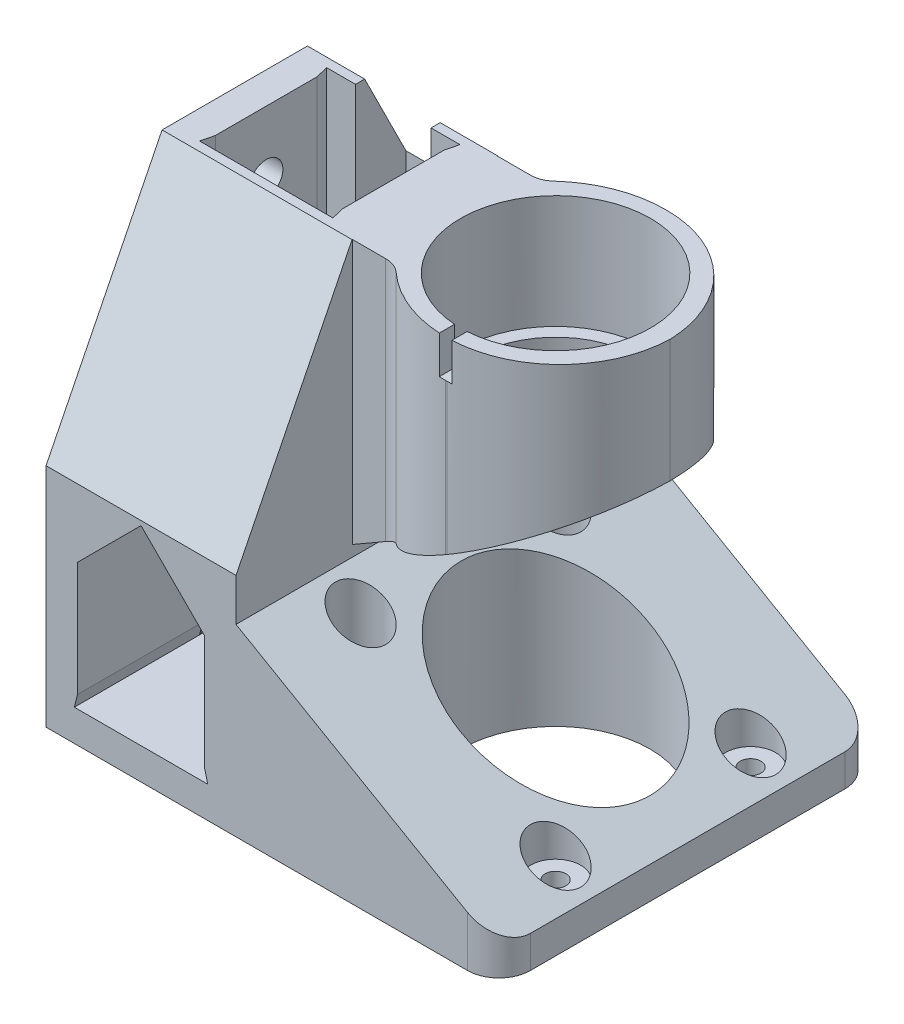
from build123d import *

# Parameters (mm, degrees)
SKETCH1_W               = 72
SKETCH1_H               = 60
BOSS_EXTRUDE1_DEPTH     = 5
SKETCH2_W               = 5
SKETCH2_H               = 60
BOSS_EXTRUDE2_DEPTH     = 68
SKETCH3_W               = 5
SKETCH3_H               = 60
BOSS_EXTRUDE3_DEPTH     = 68
BOSS_EXTRUDE4_DEPTH     = 60
CHAMFER1_SIZE           = 42
CHAMFER1_SIZE_2         = 24.248711306
CUT_EXTRUDE8_REACH      = 120.798
SKETCH12_W              = 20.2
SKETCH12_H              = 20.2
CUT_EXTRUDE1_DEPTH      = 116.792918609
CUT_EXTRUDE1_DEPTH_BACK = 116.792918609
SKETCH5_R               = 15
SKETCH8_R               = 2.65
CUT_EXTRUDE5_DEPTH      = 10
CUT_EXTRUDE6_DEPTH      = 119.798148134
CUT_EXTRUDE6_DEPTH_BACK = 119.798148134
SKETCH9_R               = 2.65
FILLET1_R               = 5
SKETCH10_R              = 2.65
CUT_EXTRUDE7_DEPTH      = 10
CUT_EXTRUDE9_DEPTH      = 119.798148134
CUT_EXTRUDE9_DEPTH_BACK = 119.798148134
CUT_EXTRUDE10_REACH     = 120.798
SKETCH14_W              = 12
SKETCH14_H              = 8
SKETCH15_W              = 35
SKETCH15_H              = 19.5
BOSS_EXTRUDE5_DEPTH     = 39
SKETCH16_R              = 15.1
CUT_EXTRUDE11_DEPTH     = 109.669222874
SKETCH17_R              = 13
CUT_EXTRUDE12_DEPTH     = 108.917792787
FILLET2_R               = 18
CHAMFER2_START          = 51.76396
CHAMFER2_OUTLINE_R      = 13
CHAMFER2_DEPTH          = 1.73604
CHAMFER2_START_2        = 31
CHAMFER2_2_OUTLINE_R    = 13
CHAMFER2_2_DEPTH        = 20.76396
CHAMFER2_START_3        = -47.5
CHAMFER2_3_DEPTH        = 35
SKETCH6_R               = 1.65
CUT_EXTRUDE2_DEPTH      = 119.798148134
SKETCH7_R               = 4
CUT_EXTRUDE4_DEPTH      = 116.792918609
SKETCH18_W              = 2
SKETCH18_H              = 15
CUT_EXTRUDE13_DEPTH     = 6
CHAMFER3_DEPTH          = 34.854175091
CUT_EXTRUDE14_REACH     = 120.798
SKETCH19_W              = 5.3
SKETCH19_H              = 10
FILLET3_R               = 19


with BuildPart() as part:
    # Sketch1 → Boss-Extrude1 (new body)
    with BuildSketch(Plane(origin=(0, 0, 0), x_dir=(1, 0, 0), z_dir=(0, 1, 0))):
        with Locations((36, 30)):
            Rectangle(SKETCH1_W, SKETCH1_H)
    extrude(amount=BOSS_EXTRUDE1_DEPTH)

    # Sketch2 → Boss-Extrude2 (add)
    with BuildSketch(Plane(origin=(0, 5, 0), x_dir=(1, 0, 0), z_dir=(0, 1, 0))):
        with Locations((2.5, 30)):
            Rectangle(SKETCH2_W, SKETCH2_H)
    extrude(amount=BOSS_EXTRUDE2_DEPTH)

    # Sketch3 → Boss-Extrude3 (add)
    with BuildSketch(Plane(origin=(0, 5, 0), x_dir=(1, 0, 0), z_dir=(0, 1, 0))):
        with Locations((27.7, 30)):
            Rectangle(SKETCH3_W, SKETCH3_H)
    extrude(amount=BOSS_EXTRUDE3_DEPTH)

    # Sketch11 → Boss-Extrude4 (add)
    with BuildSketch(Plane(origin=(0, 0, -60), x_dir=(-1, 0, 0), z_dir=(0, 0, -1))):
        Polygon((-25.2, 25.2), (-15.1, 35.3), (-5, 25.2), (-5, 73), (-25.2, 73), align=None)
    extrude(amount=-BOSS_EXTRUDE4_DEPTH)

    # Chamfer1
    # the kernel refuses this chamfer: 42, 24.248711306 mm, written as the material it adds along each edge
    with BuildSketch(Plane(origin=(30.2, 5, -60), x_dir=(1, 0, 0), z_dir=(0, 0, 1))) as chamfer1_piece_1_section:
        Polygon((CHAMFER1_SIZE, 0), (0, CHAMFER1_SIZE_2), (0, 0), align=None)
    chamfer1_piece_1 = extrude(amount=60, mode=Mode.PRIVATE)
    chamfer1_piece_1 = split(chamfer1_piece_1, bisect_by=Plane(origin=(72, 5, -60), z_dir=(-1, 0, 0)), keep=Keep.TOP, mode=Mode.PRIVATE)
    add(chamfer1_piece_1)

    # Cut-Extrude8: up to this face of the body (flat: up to its plane)
    cut_extrude8_end = Plane(part.part.faces().sort_by_distance((15.1, 5, -30))[0])
    # Sketch12 → Cut-Extrude8 (cut, up to the picked face)
    with BuildSketch(Plane(origin=(0, 73, 0), x_dir=(1, 0, 0), z_dir=(0, 1, 0)), mode=Mode.PRIVATE) as cut_extrude8_sk1:
        with Locations((15.1, 30)):
            Rectangle(SKETCH12_W, SKETCH12_H)
    cut_extrude8_tool1 = split(extrude(cut_extrude8_sk1.sketch, amount=-CUT_EXTRUDE8_REACH, mode=Mode.PRIVATE), bisect_by=cut_extrude8_end, keep=Keep.BOTH, mode=Mode.PRIVATE)
    add(cut_extrude8_tool1.solids().sort_by(Axis((15.1, 73, -30), (0, -1, 0)))[0], mode=Mode.SUBTRACT)

    # Sketch5 → Cut-Extrude1 (cut, two sides: drawn at the far end of the back side and taken through both)
    with BuildSketch(Plane(origin=(0, 5, 0), x_dir=(1, 0, 0), z_dir=(0, 1, 0)).offset(-CUT_EXTRUDE1_DEPTH_BACK)):
        with Locations(Location((51, 30, 0), (0, 0, 270))):
            Circle(SKETCH5_R)
    extrude(amount=CUT_EXTRUDE1_DEPTH + CUT_EXTRUDE1_DEPTH_BACK, mode=Mode.SUBTRACT)

    # Sketch8 → Cut-Extrude5 (cut)
    with BuildSketch(Plane(origin=(5, 0, 0), x_dir=(0, 0, -1), z_dir=(1, 0, 0))):
        with Locations((30, 63)):
            Circle(SKETCH8_R)
    extrude(amount=-CUT_EXTRUDE5_DEPTH, mode=Mode.SUBTRACT)

    # Sketch9 → Cut-Extrude6 (cut, two sides: drawn at the far end of the back side and taken through both)
    with BuildSketch(Plane.XZ.offset(-CUT_EXTRUDE6_DEPTH_BACK)):
        with Locations(Location((15, -30, 0), (0, 0, 270))):
            Circle(SKETCH9_R)
    extrude(amount=CUT_EXTRUDE6_DEPTH + CUT_EXTRUDE6_DEPTH_BACK, mode=Mode.SUBTRACT)

    # Fillet1
    fillet1_edges = [part.edges().sort_by_distance(p)[0] for p in [
        (72, 2.557735027, -60),
        (72, 2.557735027, 0),
    ]]
    fillet(fillet1_edges, radius=FILLET1_R)

    # Sketch10 → Cut-Extrude7 (cut)
    with BuildSketch(Plane.ZY):
        with Locations((-30, 15)):
            Circle(SKETCH10_R)
    extrude(amount=-CUT_EXTRUDE7_DEPTH, mode=Mode.SUBTRACT)

    # Sketch13 → Cut-Extrude9 (cut, two sides: drawn at the far end of the back side and taken through both)
    with BuildSketch(Plane.XY.offset(-CUT_EXTRUDE9_DEPTH_BACK)):
        Polygon((5, 5), (4.5, 5), (5, 7), align=None)
        Polygon((25.2, 5), (25.7, 5), (25.2, 7), align=None)
    extrude(amount=CUT_EXTRUDE9_DEPTH + CUT_EXTRUDE9_DEPTH_BACK, mode=Mode.SUBTRACT)

    # Cut-Extrude10: up to this face of the body (flat: up to its plane)
    cut_extrude10_end = Plane(part.part.faces().sort_by_distance((24.566909169, 5, -30))[0])
    # Sketch14 → Cut-Extrude10 (cut, up to the picked face)
    with BuildSketch(Plane(origin=(0, 73, 0), x_dir=(1, 0, 0), z_dir=(0, 1, 0)), mode=Mode.PRIVATE) as cut_extrude10_sk1:
        with Locations((15.1, 44.1)):
            Rectangle(SKETCH14_W, SKETCH14_H)
    cut_extrude10_tool1 = split(extrude(cut_extrude10_sk1.sketch, amount=-CUT_EXTRUDE10_REACH, mode=Mode.PRIVATE), bisect_by=cut_extrude10_end, keep=Keep.BOTH, mode=Mode.PRIVATE)
    # Sketch14 → Cut-Extrude10 (cut, up to the picked face)
    with BuildSketch(Plane(origin=(0, 73, 0), x_dir=(1, 0, 0), z_dir=(0, 1, 0)), mode=Mode.PRIVATE) as cut_extrude10_sk2:
        Polygon((25.2, 19.9), (25.7, 19.9), (25.2, 21.9), align=None)
    cut_extrude10_tool2 = split(extrude(cut_extrude10_sk2.sketch, amount=-CUT_EXTRUDE10_REACH, mode=Mode.PRIVATE), bisect_by=cut_extrude10_end, keep=Keep.BOTH, mode=Mode.PRIVATE)
    # Sketch14 → Cut-Extrude10 (cut, up to the picked face)
    with BuildSketch(Plane(origin=(0, 73, 0), x_dir=(1, 0, 0), z_dir=(0, 1, 0)), mode=Mode.PRIVATE) as cut_extrude10_sk3:
        Polygon((5, 19.9), (4.5, 19.9), (5, 21.9), align=None)
    cut_extrude10_tool3 = split(extrude(cut_extrude10_sk3.sketch, amount=-CUT_EXTRUDE10_REACH, mode=Mode.PRIVATE), bisect_by=cut_extrude10_end, keep=Keep.BOTH, mode=Mode.PRIVATE)
    # Sketch14 → Cut-Extrude10 (cut, up to the picked face)
    with BuildSketch(Plane(origin=(0, 73, 0), x_dir=(1, 0, 0), z_dir=(0, 1, 0)), mode=Mode.PRIVATE) as cut_extrude10_sk4:
        Polygon((25.2, 40.1), (25.7, 40.1), (25.2, 38.1), align=None)
    cut_extrude10_tool4 = split(extrude(cut_extrude10_sk4.sketch, amount=-CUT_EXTRUDE10_REACH, mode=Mode.PRIVATE), bisect_by=cut_extrude10_end, keep=Keep.BOTH, mode=Mode.PRIVATE)
    # Sketch14 → Cut-Extrude10 (cut, up to the picked face)
    with BuildSketch(Plane(origin=(0, 73, 0), x_dir=(1, 0, 0), z_dir=(0, 1, 0)), mode=Mode.PRIVATE) as cut_extrude10_sk5:
        Polygon((5, 40.1), (4.5, 40.1), (5, 38.1), align=None)
    cut_extrude10_tool5 = split(extrude(cut_extrude10_sk5.sketch, amount=-CUT_EXTRUDE10_REACH, mode=Mode.PRIVATE), bisect_by=cut_extrude10_end, keep=Keep.BOTH, mode=Mode.PRIVATE)
    add(cut_extrude10_tool1.solids().sort_by(Axis((15.1, 73, -44.1), (0, -1, 0)))[0], mode=Mode.SUBTRACT)
    add(cut_extrude10_tool2.solids().sort_by(Axis((25.366667, 73, -20.566667), (0, -1, 0)))[0], mode=Mode.SUBTRACT)
    add(cut_extrude10_tool3.solids().sort_by(Axis((4.833333, 73, -20.566667), (0, -1, 0)))[0], mode=Mode.SUBTRACT)
    add(cut_extrude10_tool4.solids().sort_by(Axis((25.366667, 73, -39.433333), (0, -1, 0)))[0], mode=Mode.SUBTRACT)
    add(cut_extrude10_tool5.solids().sort_by(Axis((4.833333, 73, -39.433333), (0, -1, 0)))[0], mode=Mode.SUBTRACT)

    # Sketch15 → Boss-Extrude5 (add)
    with BuildSketch(Plane(origin=(30.2, 0, 0), x_dir=(0, 0, -1), z_dir=(1, 0, 0))):
        with Locations((30, 63.25)):
            Rectangle(SKETCH15_W, SKETCH15_H)
    extrude(amount=BOSS_EXTRUDE5_DEPTH)

    # Sketch16 → Cut-Extrude11 (cut, through all)
    with BuildSketch(Plane.XZ.offset(-55)):
        with Locations(Location((51, -30, 0), (0, 0, 270))):
            Circle(SKETCH16_R)
    extrude(amount=-CUT_EXTRUDE11_DEPTH, mode=Mode.SUBTRACT)

    # Sketch17 → Cut-Extrude12 (cut, through all)
    with BuildSketch(Plane.XZ.offset(-53.5)):
        with Locations(Location((51, -30, 0), (0, 0, 270))):
            Circle(SKETCH17_R)
    extrude(amount=-CUT_EXTRUDE12_DEPTH, mode=Mode.SUBTRACT)

    # Fillet2
    # the kernel refuses this fillet: 18 mm, written as the material it takes off along each edge
    with BuildSketch(Plane(origin=(69.2, 53.5, -47.5), x_dir=(-1, 0, 0), z_dir=(0, 1, 0)), Plane(origin=(69.2, 118, -12.5), x_dir=(-1, 0, 0), z_dir=(0, -1, 0))) as fillet2_piece_1:
        with BuildLine():
            CenterArc((FILLET2_R, FILLET2_R), FILLET2_R, 180, 90)
            Line((0, FILLET2_R), (0, 0))
            Line((0, 0), (FILLET2_R, 0))
        make_face()
    extrude(amount=64.5, mode=Mode.SUBTRACT)

    # Chamfer2: read off the stored shape, not the designer's step
    # Chamfer2 outline → Chamfer2 (add)
    with BuildSketch(Plane(origin=(0, 0, 0), x_dir=(1, 0, 0), z_dir=(0, 1, 0)).offset(CHAMFER2_START)):
        with BuildLine():
            Line((30.2, 12.5), (51.2, 12.5))
            ThreePointArc((51.2, 12.5), (63.749900398, 17.596512099), (69.193054215, 30))
            ThreePointArc((69.193054215, 30), (63.749900398, 42.403487901), (51.2, 47.5))
            Line((51.2, 47.5), (30.2, 47.5))
            Line((30.2, 47.5), (30.2, 12.5))
        make_face()
        with Locations((51, 30)):
            Circle(CHAMFER2_OUTLINE_R, mode=Mode.SUBTRACT)
    extrude(amount=CHAMFER2_DEPTH)

    # Chamfer2 2 outline → Chamfer2 2 (add)
    with BuildSketch(Plane(origin=(0, 0, 0), x_dir=(1, 0, 0), z_dir=(0, 1, 0)).offset(CHAMFER2_START_2)):
        with BuildLine():
            Line((30.2, 12.5), (51.2, 12.5))
            ThreePointArc((51.2, 12.5), (63.749900398, 17.596512099), (69.193054215, 30))
            ThreePointArc((69.193054215, 30), (63.749900398, 42.403487901), (51.2, 47.5))
            Line((51.2, 47.5), (30.2, 47.5))
            Line((30.2, 47.5), (30.2, 12.5))
        make_face()
        with Locations((51, 30)):
            Circle(CHAMFER2_2_OUTLINE_R, mode=Mode.SUBTRACT)
    extrude(amount=CHAMFER2_2_DEPTH)

    # Chamfer2 3 outline → Chamfer2 3 (cut)
    with BuildSketch(Plane.XY.offset(CHAMFER2_START_3)):
        Polygon((71, 53.5), (69.17114317, 53.5), (30.2, 31), (71, 31), align=None)
    extrude(amount=CHAMFER2_3_DEPTH, mode=Mode.SUBTRACT)

    # Sketch6 → Cut-Extrude2 (cut, through all)
    with BuildSketch(Plane.XZ):
        with Locations(Location((66.5, -14.5, 0), (0, 0, 270))):
            Circle(SKETCH6_R)
        with Locations(Location((66.5, -45.5, 0), (0, 0, 270))):
            Circle(SKETCH6_R)
        with Locations(Location((35.5, -45.5, 0), (0, 0, 270))):
            Circle(SKETCH6_R)
        with Locations(Location((35.5, -14.5, 0), (0, 0, 270))):
            Circle(SKETCH6_R)
    extrude(amount=-CUT_EXTRUDE2_DEPTH, mode=Mode.SUBTRACT)

    # Sketch7 → Cut-Extrude4 (cut, through all)
    with BuildSketch(Plane(origin=(0, 5, 0), x_dir=(1, 0, 0), z_dir=(0, 1, 0))):
        with Locations((66.5, 45.5)):
            Circle(SKETCH7_R)
        with Locations((66.5, 14.5)):
            Circle(SKETCH7_R)
        with Locations((35.5, 14.5)):
            Circle(SKETCH7_R)
        with Locations((35.5, 45.5)):
            Circle(SKETCH7_R)
    extrude(amount=CUT_EXTRUDE4_DEPTH, mode=Mode.SUBTRACT)

    # Sketch18 → Cut-Extrude13 (cut)
    with BuildSketch(Plane(origin=(0, 73, 0), x_dir=(1, 0, 0), z_dir=(0, 1, 0))):
        with Locations((51, 15)):
            Rectangle(SKETCH18_W, SKETCH18_H)
    extrude(amount=-CUT_EXTRUDE13_DEPTH, mode=Mode.SUBTRACT)

    # Chamfer3: read off the stored shape, not the designer's step
    # Chamfer3 outline → Chamfer3 (cut)
    with BuildSketch(Plane.YZ):
        Polygon((73, -41.552480502), (36, -60), (73, -60), align=None)
        Polygon((73, -18.447519498), (73, 0), (36, 0), align=None)
    extrude(amount=CHAMFER3_DEPTH, mode=Mode.SUBTRACT)

    # Cut-Extrude14: up to this plane
    cut_extrude14_end = Plane(origin=(69.17114317, 53.5, -12.5), z_dir=(0.4999999999999951, -0.8660254037844415, 0))
    # Sketch19 → Cut-Extrude14 (cut, up to the surface)
    with BuildSketch(Plane(origin=(0, 73, 0), x_dir=(1, 0, 0), z_dir=(0, 1, 0)), mode=Mode.PRIVATE) as cut_extrude14_sk1:
        with Locations((32.85, 46.5)):
            Rectangle(SKETCH19_W, SKETCH19_H)
    cut_extrude14_tool1 = split(extrude(cut_extrude14_sk1.sketch, amount=-CUT_EXTRUDE14_REACH, mode=Mode.PRIVATE), bisect_by=cut_extrude14_end, keep=Keep.BOTH, mode=Mode.PRIVATE)
    add(cut_extrude14_tool1.solids().sort_by_distance((32.85, 73, -46.5))[0], mode=Mode.SUBTRACT)
    # Sketch19 → Cut-Extrude14 (cut, up to the surface)
    with BuildSketch(Plane(origin=(0, 73, 0), x_dir=(1, 0, 0), z_dir=(0, 1, 0)), mode=Mode.PRIVATE) as cut_extrude14_sk2:
        with Locations((32.85, 13.5)):
            Rectangle(SKETCH19_W, SKETCH19_H)
    cut_extrude14_tool2 = split(extrude(cut_extrude14_sk2.sketch, amount=-CUT_EXTRUDE14_REACH, mode=Mode.PRIVATE), bisect_by=cut_extrude14_end, keep=Keep.BOTH, mode=Mode.PRIVATE)
    add(cut_extrude14_tool2.solids().sort_by_distance((32.85, 73, -13.5))[0], mode=Mode.SUBTRACT)

    # Fillet3
    # the kernel refuses this fillet: 19 mm, written as the material it takes off along each edge
    with BuildSketch(Plane(origin=(38.964101615, 103.069579424, -47.5), x_dir=(-0.15348078303454, 0, 0.9881516327159028), z_dir=(0, -1, 0))) as fillet3_piece_1:
        with BuildLine():
            CenterArc((16.928839983, -14.801456479), FILLET3_R, 128.828697274, 42.342605452)
            Line((-1.846041038, -11.885321601), (0, 0))
            ThreePointArc((0, 0), (2.507976294, -0.883903899), (5.015952588, 0))
        make_face()
    extrude(amount=49.569579424, mode=Mode.SUBTRACT)
    with BuildSketch(Plane(origin=(38.964101615, 103.069579424, -12.5), x_dir=(1, 0, 0), z_dir=(0, -1, 0))) as fillet3_piece_2:
        with BuildLine():
            CenterArc((12.02783177, -19), FILLET3_R, 90, 42.342605452)
            ThreePointArc((-0.769852331, -4.956521739), (0.488504916, -2.613923132), (0, 0))
            Line((0, 0), (12.02783177, 0))
        make_face()
    extrude(amount=49.569579424, mode=Mode.SUBTRACT)
    with BuildSketch(Plane(origin=(38.964101615, 53.5, -12.5), x_dir=(1, 0, 0), z_dir=(0, -1, 0))) as fillet3_piece_3:
        with BuildLine():
            CenterArc((12.02783177, -19), FILLET3_R, 90, 42.342605452)
            ThreePointArc((-0.769852331, -4.956521739), (0.488504916, -2.613923132), (0, 0))
            Line((0, 0), (12.02783177, 0))
        make_face()
    extrude(amount=1.73604, mode=Mode.SUBTRACT)
    with BuildSketch(Plane(origin=(38.964101615, 51.76396, -12.5), x_dir=(1, 0, 0), z_dir=(0, -1, 0))) as fillet3_piece_4_section:
        with BuildLine():
            CenterArc((12.02783177, -19), FILLET3_R, 90, 42.342605452)
            ThreePointArc((-0.769852331, -4.956521739), (0.488504916, -2.613923132), (0, 0))
            Line((0, 0), (12.02783177, 0))
        make_face()
    fillet3_piece_4 = extrude(amount=45.773582997, mode=Mode.PRIVATE)
    fillet3_piece_4 = split(fillet3_piece_4, bisect_by=Plane(origin=(45.764134633, 39.98595732, -12.5), z_dir=(-0.5000000000028844, 0.8660254037827734, 0)), keep=Keep.TOP, mode=Mode.PRIVATE)
    add(fillet3_piece_4, mode=Mode.SUBTRACT)
    with BuildSketch(Plane(origin=(38.964101615, 53.5, -47.5), x_dir=(1, 0, 0), z_dir=(0, -1, 0))) as fillet3_piece_5:
        with BuildLine():
            CenterArc((12.02783177, 19), FILLET3_R, 227.657394548, 42.342605452)
            ThreePointArc((-0.769852331, 4.956521739), (0.488504916, 2.613923132), (0, 0))
            Line((0, 0), (12.02783177, 0))
        make_face()
    extrude(amount=1.73604, mode=Mode.SUBTRACT)
    with BuildSketch(Plane(origin=(38.964101615, 51.76396, -47.5), x_dir=(1, 0, 0), z_dir=(0, -1, 0))) as fillet3_piece_6_section:
        with BuildLine():
            CenterArc((12.02783177, 19), FILLET3_R, 227.657394548, 42.342605452)
            ThreePointArc((-0.769852331, 4.956521739), (0.488504916, 2.613923132), (0, 0))
            Line((0, 0), (12.02783177, 0))
        make_face()
    fillet3_piece_6 = extrude(amount=45.773582997, mode=Mode.PRIVATE)
    fillet3_piece_6 = split(fillet3_piece_6, bisect_by=Plane(origin=(45.764134633, 39.98595732, -47.5), z_dir=(-0.5000000000028844, 0.8660254037827734, 0)), keep=Keep.TOP, mode=Mode.PRIVATE)
    add(fillet3_piece_6, mode=Mode.SUBTRACT)


solid = part.part
